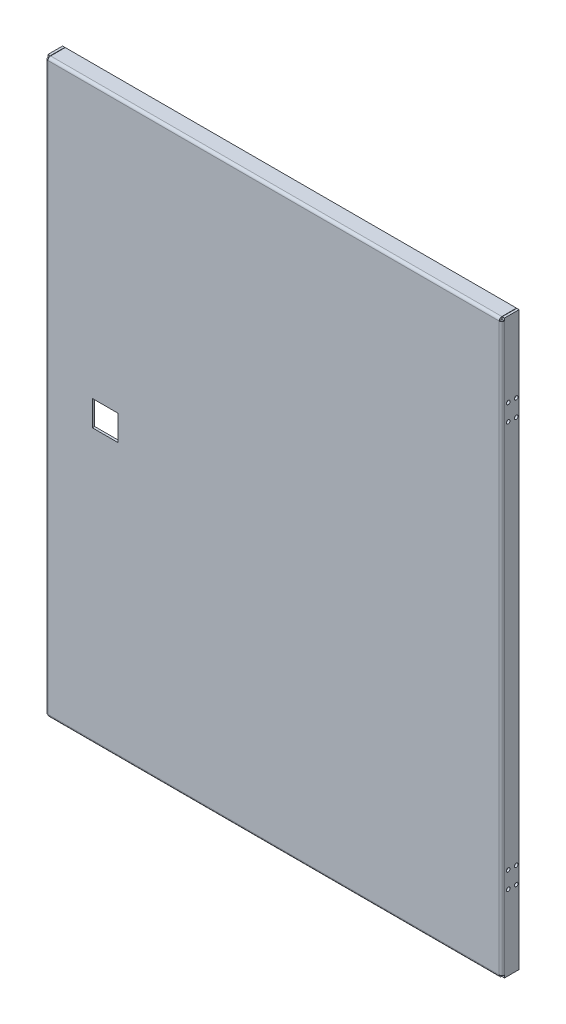
from build123d import *

# Parameters (mm, degrees)
SKETCH_1_W                         = 397
SKETCH_1_H                         = 497
SKETCH_1_W_2                       = 22.1
SKETCH_1_H_2                       = 22.1
SM_BASE_FLANGE_1_DEPTH             = 2
SM_EDGE_FLANGE_1_STRIP_W           = 8.6
SM_EDGE_FLANGE_1_STRIP_H           = 2
SM_EDGE_FLANGE_1_STRIP_CUT_DEPTH   = 497
SM_EDGE_FLANGE_1_STRIP_2_W         = 8.6
SM_EDGE_FLANGE_1_STRIP_2_H         = 2
SM_EDGE_FLANGE_1_STRIP_CUT_2_DEPTH = 497
SM_EDGE_FLANGE_1_DEPTH             = 497
SM_EDGE_FLANGE_1_BEND_DEPTH        = 497
SM_START                           = -198.5
SM_EDGE_FLANGE_2_DEPTH             = 397
SM_EDGE_FLANGE_2_2_DEPTH           = 2.3
SM_START_2                         = 196.2
SM_EDGE_FLANGE_2_3_DEPTH           = 2.3
SM_START_3                         = -196.2
SM_EDGE_FLANGE_2_4_DEPTH           = 392.4
SKETCH_18_R                        = 1.6
CUT_EXTRUDE_1_DEPTH                = 10


# Read off the part's stored shape, not the designer's step: 边线-法兰2
# Sheet-metal steps are written as plain solids
with BuildPart() as part:
    # Sketch 1 → 基体-法兰1 (new body)
    with BuildSketch(Plane.XY):
        Rectangle(SKETCH_1_W, SKETCH_1_H)
        with Locations((-146.5, 0)):
            Rectangle(SKETCH_1_W_2, SKETCH_1_H_2, mode=Mode.SUBTRACT)
    extrude(amount=-SM_BASE_FLANGE_1_DEPTH)

    # 边线-法兰1 strip (across the edge) → 边线-法兰1 strip cut (cut)
    with BuildSketch(Plane(origin=(198.5, 248.5, -2), x_dir=(-1, 0, 0), z_dir=(0, -1, 0))):
        with Locations((-2, -1)):
            Rectangle(SM_EDGE_FLANGE_1_STRIP_W, SM_EDGE_FLANGE_1_STRIP_H)
    extrude(amount=SM_EDGE_FLANGE_1_STRIP_CUT_DEPTH, mode=Mode.SUBTRACT)

    # 边线-法兰1 strip 2 (across the edge) → 边线-法兰1 strip cut 2 (cut)
    with BuildSketch(Plane(origin=(-198.5, -248.5, -2), x_dir=(1, 0, 0), z_dir=(0, 1, 0))):
        with Locations((-2, -1)):
            Rectangle(SM_EDGE_FLANGE_1_STRIP_2_W, SM_EDGE_FLANGE_1_STRIP_2_H)
    extrude(amount=SM_EDGE_FLANGE_1_STRIP_CUT_2_DEPTH, mode=Mode.SUBTRACT)

    # 边线-法兰1 section (across the edge) → 边线-法兰1 (add)
    with BuildSketch(Plane(origin=(198.5, 248.5, -2), x_dir=(-1, 0, 0), z_dir=(0, -1, 0))):
        with BuildLine():
            Line((0, 0.3), (0, 13))
            Line((0, 13), (2, 13))
            Line((2, 13), (2, 0.3))
            ThreePointArc((2, 0.3), (2.087867966, 0.087867966), (2.3, 0))
            Line((2.3, 0), (2.3, -2))
            ThreePointArc((2.3, -2), (0.673654403, -1.326345597), (0, 0.3))
        make_face()
    extrude(amount=SM_EDGE_FLANGE_1_DEPTH)

    # 边线-法兰1 section 2 (across the edge) → 边线-法兰1 bend (add)
    with BuildSketch(Plane(origin=(-198.5, -248.5, -2), x_dir=(1, 0, 0), z_dir=(0, 1, 0))):
        with BuildLine():
            Line((0, 0.3), (0, 13))
            Line((0, 13), (2, 13))
            Line((2, 13), (2, 0.3))
            ThreePointArc((2, 0.3), (2.087867966, 0.087867966), (2.3, 0))
            Line((2.3, 0), (2.3, -2))
            ThreePointArc((2.3, -2), (0.673654403, -1.326345597), (0, 0.3))
        make_face()
    extrude(amount=SM_EDGE_FLANGE_1_BEND_DEPTH)

    # 边线-法兰2 outline → 边线-法兰2 (cut)
    with BuildSketch(Plane.YZ.offset(SM_START)):
        with BuildLine():
            Line((-246.5, -2.3), (-246.2, -2.3))
            Line((-246.2, -2.3), (-246.2, -2))
            ThreePointArc((-246.2, -2), (-246.412132034, -2.087867966), (-246.5, -2.3))
        make_face()
        with BuildLine():
            ThreePointArc((-248.5, -2.3), (-247.826345597, -0.673654403), (-246.2, 0))
            Line((-246.2, 0), (-248.5, 0))
            Line((-248.5, 0), (-248.5, -2.3))
        make_face()
        with BuildLine():
            ThreePointArc((246.5, -2.3), (246.412132034, -2.087867966), (246.2, -2))
            Line((246.2, -2), (246.2, -2.3))
            Line((246.2, -2.3), (246.5, -2.3))
        make_face()
        with BuildLine():
            Line((248.5, 0), (246.2, 0))
            ThreePointArc((246.2, 0), (247.826345597, -0.673654403), (248.5, -2.3))
            Line((248.5, -2.3), (248.5, 0))
        make_face()
    extrude(amount=SM_EDGE_FLANGE_2_DEPTH, mode=Mode.SUBTRACT)

    # Sm Edge Flange 2 2 outline → Sm Edge Flange 2 2 (cut)
    with BuildSketch(Plane.YZ.offset(SM_START)):
        with BuildLine():
            Line((-248.5, -2.3), (-246.5, -2.3))
            ThreePointArc((-246.5, -2.3), (-246.412132034, -2.087867966), (-246.2, -2))
            Line((-246.2, -2), (-246.2, 0))
            ThreePointArc((-246.2, 0), (-247.826345597, -0.673654403), (-248.5, -2.3))
        make_face()
        with BuildLine():
            ThreePointArc((248.5, -2.3), (247.826345597, -0.673654403), (246.2, 0))
            Line((246.2, 0), (246.2, -2))
            ThreePointArc((246.2, -2), (246.412132034, -2.087867966), (246.5, -2.3))
            Line((246.5, -2.3), (248.5, -2.3))
        make_face()
    extrude(amount=SM_EDGE_FLANGE_2_2_DEPTH, mode=Mode.SUBTRACT)

    # Sm Edge Flange 2 3 outline → Sm Edge Flange 2 3 (cut)
    with BuildSketch(Plane.YZ.offset(SM_START_2)):
        with BuildLine():
            Line((-248.5, -2.3), (-246.5, -2.3))
            ThreePointArc((-246.5, -2.3), (-246.412132034, -2.087867966), (-246.2, -2))
            Line((-246.2, -2), (-246.2, 0))
            ThreePointArc((-246.2, 0), (-247.826345597, -0.673654403), (-248.5, -2.3))
        make_face()
        with BuildLine():
            ThreePointArc((248.5, -2.3), (247.826345597, -0.673654403), (246.2, 0))
            Line((246.2, 0), (246.2, -2))
            ThreePointArc((246.2, -2), (246.412132034, -2.087867966), (246.5, -2.3))
            Line((246.5, -2.3), (248.5, -2.3))
        make_face()
    extrude(amount=SM_EDGE_FLANGE_2_3_DEPTH, mode=Mode.SUBTRACT)

    # Sm Edge Flange 2 4 outline → Sm Edge Flange 2 4 (add)
    with BuildSketch(Plane.YZ.offset(SM_START_3)):
        with BuildLine():
            Line((-246.5, -15), (-246.5, -2.3))
            ThreePointArc((-246.5, -2.3), (-246.412132034, -2.087867966), (-246.2, -2))
            Line((-246.2, -2), (-248.48035085, -2))
            ThreePointArc((-248.48035085, -2), (-248.495082456, -2.149678603), (-248.5, -2.3))
            Line((-248.5, -2.3), (-248.5, -15))
            Line((-248.5, -15), (-246.5, -15))
        make_face()
        with BuildLine():
            Line((248.48035085, -2), (246.2, -2))
            ThreePointArc((246.2, -2), (246.412132034, -2.087867966), (246.5, -2.3))
            Line((246.5, -2.3), (246.5, -15))
            Line((246.5, -15), (248.5, -15))
            Line((248.5, -15), (248.5, -2.3))
            ThreePointArc((248.5, -2.3), (248.495082456, -2.149678603), (248.48035085, -2))
        make_face()
    extrude(amount=SM_EDGE_FLANGE_2_4_DEPTH)

    # 草图18 → 切除-拉伸1 (cut)
    with BuildSketch(Plane(origin=(198.5, 0, 0), x_dir=(0, 0, -1), z_dir=(1, 0, 0))):
        with Locations((5.5, -183.25)):
            Circle(SKETCH_18_R)
        with Locations((12.5, -183.25)):
            Circle(SKETCH_18_R)
        with Locations((5.5, -168.75)):
            Circle(SKETCH_18_R)
        with Locations((12.5, -168.75)):
            Circle(SKETCH_18_R)
        with Locations(Location((12.5, 168.75, 0), (0, 0, 180))):
            Circle(SKETCH_18_R)
        with Locations(Location((5.5, 168.75, 0), (0, 0, 180))):
            Circle(SKETCH_18_R)
        with Locations(Location((12.5, 183.25, 0), (0, 0, 180))):
            Circle(SKETCH_18_R)
        with Locations(Location((5.5, 183.25, 0), (0, 0, 180))):
            Circle(SKETCH_18_R)
    extrude(amount=-CUT_EXTRUDE_1_DEPTH, mode=Mode.SUBTRACT)


solid = part.part
